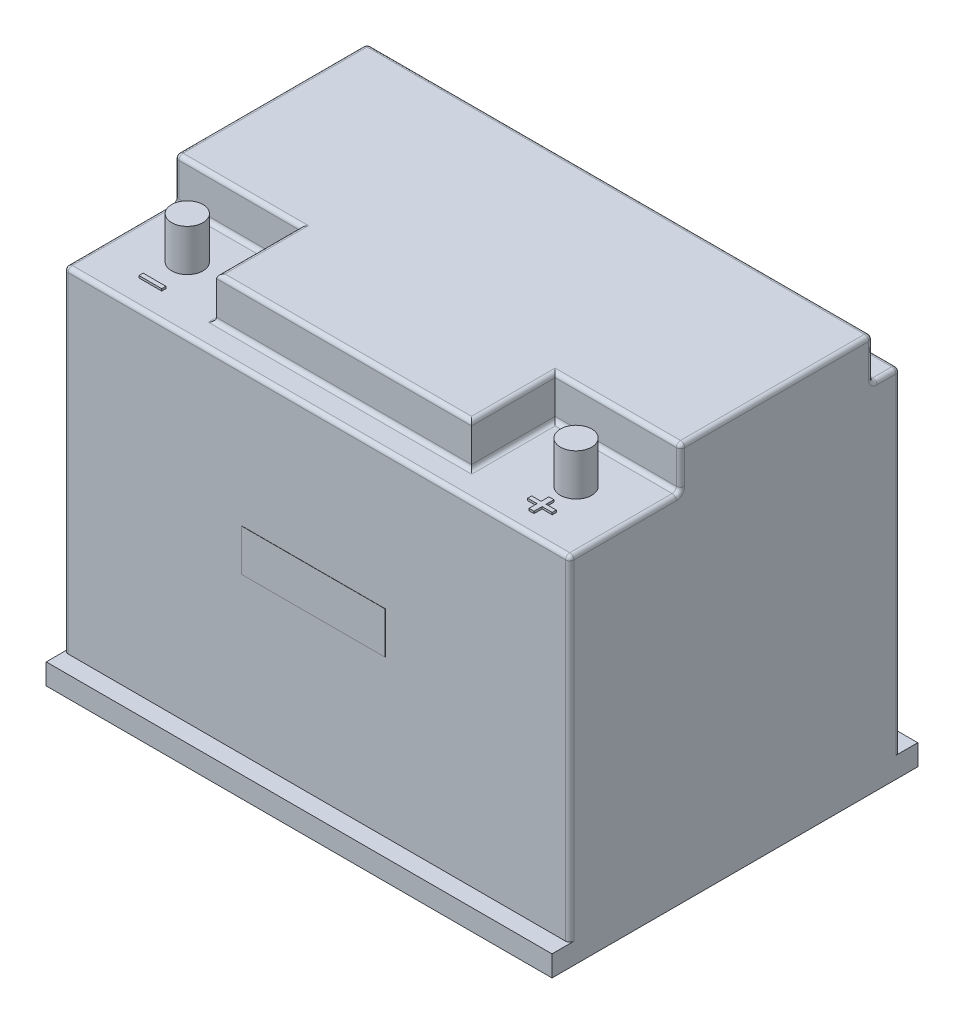
from build123d import *

# Parameters (mm, degrees)
SKETCH_1_W          = 242
SKETCH_1_H          = 175
EXTRUDE_1_DEPTH     = 10
SKETCH_2_W          = 242
SKETCH_2_H          = 158
EXTRUDE_2_DEPTH     = 160
SKETCH_3_W          = 242
SKETCH_3_H          = 132
EXTRUDE_3_DEPTH     = 20
SKETCH_4_W          = 60
SKETCH_4_H          = 40
CUT_EXTRUDE_1_DEPTH = 20
SKETCH_5_W          = 60
SKETCH_5_H          = 40
CUT_EXTRUDE_2_DEPTH = 20
FILLET_2_R          = 2
FILLET_3_R          = 2
FILLET_4_R          = 2
FILLET_5_R          = 2
FILLET_6_R          = 2
FILLET_7_R          = 2
FILLET_8_R          = 2
SKETCH_6_R          = 7.5
EXTRUDE_4_DEPTH     = 20
SKETCH_7_R          = 7.5
EXTRUDE_5_DEPTH     = 20
SKETCH_9_W          = 10.902570875
SKETCH_9_H          = 2.008368319
EXTRUDE_6_DEPTH     = 1
SKETCH_10_W         = 11.773146019
SKETCH_10_H         = 1.940628464
EXTRUDE_7_DEPTH     = 1
SKETCH_11_W         = 2.42536198
SKETCH_11_H         = 9.534181576
EXTRUDE_8_DEPTH     = 1
SKETCH_12_W         = 68.811606865
SKETCH_12_H         = 20.02454168
EXTRUDE_9_DEPTH     = 0.1


with BuildPart() as part:
    # 草图1 → 凸台-拉伸1 (new body)
    with BuildSketch(Plane(origin=(0, 0, 0), x_dir=(1, 0, 0), z_dir=(0, 1, 0))):
        Rectangle(SKETCH_1_W, SKETCH_1_H)
    extrude(amount=EXTRUDE_1_DEPTH)

    # 草图2 → 凸台-拉伸2 (add)
    with BuildSketch(Plane(origin=(0, 10, 0), x_dir=(1, 0, 0), z_dir=(0, 1, 0))):
        Rectangle(SKETCH_2_W, SKETCH_2_H)
    extrude(amount=EXTRUDE_2_DEPTH)

    # 草图3 → 凸台-拉伸3 (add)
    with BuildSketch(Plane(origin=(0, 170, 0), x_dir=(1, 0, 0), z_dir=(0, 1, 0))):
        Rectangle(SKETCH_3_W, SKETCH_3_H)
    extrude(amount=EXTRUDE_3_DEPTH)

    # 草图4 → 切除-拉伸1 (cut)
    with BuildSketch(Plane(origin=(0, 170, 0), x_dir=(1, 0, 0), z_dir=(0, 1, 0))):
        with Locations((-91, -46)):
            Rectangle(SKETCH_4_W, SKETCH_4_H)
    extrude(amount=CUT_EXTRUDE_1_DEPTH, mode=Mode.SUBTRACT)

    # 草图5 → 切除-拉伸2 (cut)
    with BuildSketch(Plane(origin=(0, 170, 0), x_dir=(1, 0, 0), z_dir=(0, 1, 0))):
        with Locations((91, -46)):
            Rectangle(SKETCH_5_W, SKETCH_5_H)
    extrude(amount=CUT_EXTRUDE_2_DEPTH, mode=Mode.SUBTRACT)

    # 圆角2
    fillet_2_edges = [part.edges().sort_by_distance(p)[0] for p in [
        (-121, 90, 79),
    ]]
    fillet(fillet_2_edges, radius=FILLET_2_R)

    # 圆角3
    fillet_3_edges = [part.edges().sort_by_distance(p)[0] for p in [
        (121, 90, 79),
    ]]
    fillet(fillet_3_edges, radius=FILLET_3_R)

    # 圆角4
    fillet_4_edges = [part.edges().sort_by_distance(p)[0] for p in [
        (121, 90, -79),
    ]]
    fillet(fillet_4_edges, radius=FILLET_4_R)

    # 圆角5
    fillet_5_edges = [part.edges().sort_by_distance(p)[0] for p in [
        (-121, 90, -79),
    ]]
    fillet(fillet_5_edges, radius=FILLET_5_R)

    # 圆角6
    fillet_6_edges = [part.edges().sort_by_distance(p)[0] for p in [
        (-61, 190, 46),
        (-91, 190, 26),
        (-121, 190, -20),
        (0, 190, -66),
        (121, 190, -20),
        (91, 190, 26),
        (61, 190, 46),
        (0, 190, 66),
    ]]
    fillet(fillet_6_edges, radius=FILLET_6_R)

    # 圆角7
    # the kernel refuses this fillet: 2 mm, written as the material it adds along each edge
    with BuildSketch(Plane(origin=(61, 170, 66), x_dir=(0, 0, 1), z_dir=(-1, 0, 0))) as fillet_7_piece_1:
        with BuildLine():
            CenterArc((FILLET_7_R, FILLET_7_R), FILLET_7_R, 180, 90)
            Line((0, FILLET_7_R), (0, 0))
            Line((0, 0), (FILLET_7_R, 0))
        make_face()
    extrude(amount=122)
    with BuildSketch(Plane(origin=(-121, 170, 26), x_dir=(0, 1, 0), z_dir=(1, 0, 0))) as fillet_7_piece_2:
        with BuildLine():
            CenterArc((FILLET_7_R, FILLET_7_R), FILLET_7_R, 180, 90)
            Line((0, FILLET_7_R), (0, 0))
            Line((0, 0), (FILLET_7_R, 0))
        make_face()
    extrude(amount=65)
    with BuildSketch(Plane(origin=(-61, 170, 21), x_dir=(-1, 0, 0), z_dir=(0, 0, 1)), Plane(origin=(61, 170, 66), x_dir=(1, 0, 0), z_dir=(0, 0, -1))) as fillet_7_piece_3:
        with BuildLine():
            CenterArc((FILLET_7_R, -FILLET_7_R), FILLET_7_R, 90, 90)
            Line((0, -FILLET_7_R), (0, 0))
            Line((0, 0), (FILLET_7_R, 0))
        make_face()
    extrude(amount=45)
    with BuildSketch(Plane(origin=(56, 170, 26), x_dir=(0, 0, 1), z_dir=(1, 0, 0))) as fillet_7_piece_4:
        with BuildLine():
            CenterArc((FILLET_7_R, -FILLET_7_R), FILLET_7_R, 90, 90)
            Line((0, -FILLET_7_R), (0, 0))
            Line((0, 0), (FILLET_7_R, 0))
        make_face()
    extrude(amount=65)
    with BuildSketch(Plane(origin=(61, 170, 71), x_dir=(1, 0, 0), z_dir=(0, 0, -1))) as fillet_7_piece_5a_section:
        with BuildLine():
            CenterArc((FILLET_7_R, -FILLET_7_R), FILLET_7_R, 90, 90)
            Line((0, -FILLET_7_R), (0, 0))
            Line((0, 0), (FILLET_7_R, 0))
        make_face()
    fillet_7_piece_5a = extrude(amount=45, mode=Mode.PRIVATE)
    fillet_7_piece_5a = split(fillet_7_piece_5a, bisect_by=Plane(origin=(61.452790229, 170.452790229, 66), z_dir=(0, 0, 1)), keep=Keep.TOP, mode=Mode.PRIVATE)
    with BuildSketch(Plane(origin=(66, 170, 66), x_dir=(0, 0, 1), z_dir=(-1, 0, 0))) as fillet_7_piece_5b_section:
        with BuildLine():
            CenterArc((FILLET_7_R, FILLET_7_R), FILLET_7_R, 180, 90)
            Line((0, FILLET_7_R), (0, 0))
            Line((0, 0), (FILLET_7_R, 0))
        make_face()
    fillet_7_piece_5b = extrude(amount=127, mode=Mode.PRIVATE)
    fillet_7_piece_5b = split(fillet_7_piece_5b, bisect_by=Plane(origin=(61, 170.452790229, 66.452790229), z_dir=(1, 0, 0)), keep=Keep.TOP, mode=Mode.PRIVATE)
    fillet_7_piece_5 = fillet_7_piece_5a & fillet_7_piece_5b
    add(fillet_7_piece_5)
    with BuildSketch(Plane(origin=(-61, 170, 26), x_dir=(-1, 0, 0), z_dir=(0, 0, 1))) as fillet_7_piece_6a_section:
        with BuildLine():
            CenterArc((FILLET_7_R, -FILLET_7_R), FILLET_7_R, 90, 90)
            Line((0, -FILLET_7_R), (0, 0))
            Line((0, 0), (FILLET_7_R, 0))
        make_face()
    fillet_7_piece_6a = extrude(amount=45, mode=Mode.PRIVATE)
    fillet_7_piece_6a = split(fillet_7_piece_6a, bisect_by=Plane(origin=(-61.452790229, 170.452790229, 66), z_dir=(0, 0, 1)), keep=Keep.TOP, mode=Mode.PRIVATE)
    with BuildSketch(Plane(origin=(61, 170, 66), x_dir=(0, 0, 1), z_dir=(-1, 0, 0))) as fillet_7_piece_6b_section:
        with BuildLine():
            CenterArc((FILLET_7_R, FILLET_7_R), FILLET_7_R, 180, 90)
            Line((0, FILLET_7_R), (0, 0))
            Line((0, 0), (FILLET_7_R, 0))
        make_face()
    fillet_7_piece_6b = extrude(amount=127, mode=Mode.PRIVATE)
    fillet_7_piece_6b = split(fillet_7_piece_6b, bisect_by=Plane(origin=(-61, 170.452790229, 66.452790229), z_dir=(-1, 0, 0)), keep=Keep.TOP, mode=Mode.PRIVATE)
    fillet_7_piece_6 = fillet_7_piece_6a & fillet_7_piece_6b
    add(fillet_7_piece_6)
    # the kernel refuses this fillet: 2 mm, written as the material it takes off along each edge
    with BuildSketch(Plane(origin=(119, 188, 24), x_dir=(0, 0, 1), z_dir=(1, 0, 0))) as fillet_7_2_piece_1_section:
        Polygon((0, 0), (FILLET_7_R, 0), (FILLET_7_R, -FILLET_7_R), (0, -FILLET_7_R), align=None)
    fillet_7_2_piece_1 = extrude(amount=FILLET_7_R, mode=Mode.PRIVATE)
    fillet_7_2_piece_1 = fillet_7_2_piece_1 - Plane(origin=(119, 188, 24), x_dir=(0, -0.7071067811865475, -0.7071067811865475), z_dir=(1, 0, 0)) * Sphere(FILLET_7_R, mode=Mode.PRIVATE)
    add(fillet_7_2_piece_1, mode=Mode.SUBTRACT)
    with BuildSketch(Plane(origin=(-119, 188, 24), x_dir=(-1, 0, 0), z_dir=(0, 0, 1))) as fillet_7_2_piece_2_section:
        Polygon((0, 0), (FILLET_7_R, 0), (FILLET_7_R, -FILLET_7_R), (0, -FILLET_7_R), align=None)
    fillet_7_2_piece_2 = extrude(amount=FILLET_7_R, mode=Mode.PRIVATE)
    fillet_7_2_piece_2 = fillet_7_2_piece_2 - Plane(origin=(-119, 188, 24), x_dir=(0.7071067811865475, -0.7071067811865475, 0), z_dir=(0, 0, 1)) * Sphere(FILLET_7_R, mode=Mode.PRIVATE)
    add(fillet_7_2_piece_2, mode=Mode.SUBTRACT)
    with BuildSketch(Plane(origin=(-121, 172, 26), x_dir=(1, 0, 0), z_dir=(0, 1, 0)), Plane(origin=(121, 172, 26), x_dir=(0, 0, -1), z_dir=(0, 1, 0))) as fillet_7_2_piece_3:
        with BuildLine():
            CenterArc((FILLET_7_R, FILLET_7_R), FILLET_7_R, 180, 90)
            Line((0, FILLET_7_R), (0, 0))
            Line((0, 0), (FILLET_7_R, 0))
        make_face()
    extrude(amount=16, mode=Mode.SUBTRACT)
    with BuildSketch(Plane(origin=(-121, 170, 77), x_dir=(1, 0, 0), z_dir=(0, 0, -1))) as fillet_7_2_piece_4:
        with BuildLine():
            CenterArc((FILLET_7_R, FILLET_7_R), FILLET_7_R, 180, 90)
            Line((0, FILLET_7_R), (0, 0))
            Line((0, 0), (FILLET_7_R, 0))
        make_face()
    extrude(amount=49, mode=Mode.SUBTRACT)
    with BuildSketch(Plane(origin=(119, 170, 79), x_dir=(0, -1, 0), z_dir=(-1, 0, 0))) as fillet_7_2_piece_5:
        with BuildLine():
            CenterArc((FILLET_7_R, -FILLET_7_R), FILLET_7_R, 90, 90)
            Line((0, -FILLET_7_R), (0, 0))
            Line((0, 0), (FILLET_7_R, 0))
        make_face()
    extrude(amount=238, mode=Mode.SUBTRACT)
    with BuildSketch(Plane(origin=(-119, 170, 77), x_dir=(0, 0, 1), z_dir=(1, 0, 0))) as fillet_7_2_piece_6:
        with BuildLine():
            CenterArc((2 - FILLET_7_R, FILLET_7_R), FILLET_7_R, 270, 90)
            Line((2 - FILLET_7_R, 0), (2, 0))
            Line((2, 0), (2, FILLET_7_R))
        make_face()
    revolve(axis=Axis((-119, 170, 77), (0, -1, 0)), revolution_arc=90, mode=Mode.SUBTRACT)
    with BuildSketch(Plane(origin=(121, 170, 28), x_dir=(0, -1, 0), z_dir=(0, 0, 1))) as fillet_7_2_piece_7:
        with BuildLine():
            CenterArc((FILLET_7_R, -FILLET_7_R), FILLET_7_R, 90, 90)
            Line((0, -FILLET_7_R), (0, 0))
            Line((0, 0), (FILLET_7_R, 0))
        make_face()
    extrude(amount=49, mode=Mode.SUBTRACT)
    with BuildSketch(Plane(origin=(119, 170, 77), x_dir=(1, 0, 0), z_dir=(0, 0, -1))) as fillet_7_2_piece_8:
        with BuildLine():
            CenterArc((2 - FILLET_7_R, FILLET_7_R), FILLET_7_R, 270, 90)
            Line((2 - FILLET_7_R, 0), (2, 0))
            Line((2, 0), (2, FILLET_7_R))
        make_face()
    revolve(axis=Axis((119, 170, 77), (0, -1, 0)), revolution_arc=90, mode=Mode.SUBTRACT)
    with BuildSketch(Plane(origin=(121, 172, 28), x_dir=(0, -1, 0), z_dir=(0, 0, 1))) as fillet_7_2_piece_9:
        with BuildLine():
            CenterArc((2 + FILLET_7_R, -FILLET_7_R), FILLET_7_R, 90, 90)
            Line((2, -FILLET_7_R), (2, 0))
            Line((2, 0), (2 + FILLET_7_R, 0))
        make_face()
    revolve(axis=Axis((121, 172, 28), (1, 0, 0)), revolution_arc=90, mode=Mode.SUBTRACT)
    with BuildSketch(Plane(origin=(-121, 172, 28), x_dir=(0, 0, -1), z_dir=(0, 1, 0))) as fillet_7_2_piece_10:
        with BuildLine():
            CenterArc((2 + FILLET_7_R, -FILLET_7_R), FILLET_7_R, 90, 90)
            Line((2 + FILLET_7_R, 0), (2, 0))
            Line((2, 0), (2, -FILLET_7_R))
        make_face()
    revolve(axis=Axis((-121, 172, 28), (-1, 0, 0)), revolution_arc=90, mode=Mode.SUBTRACT)

    # 圆角8
    # the kernel refuses this fillet: 2 mm, written as the material it adds along each edge
    with BuildSketch(Plane(origin=(-121, 170, -66), x_dir=(0, 0, -1), z_dir=(1, 0, 0))) as fillet_8_piece_1:
        with BuildLine():
            CenterArc((FILLET_8_R, FILLET_8_R), FILLET_8_R, 180, 90)
            Line((0, FILLET_8_R), (0, 0))
            Line((0, 0), (FILLET_8_R, 0))
        make_face()
    extrude(amount=242)
    # the kernel refuses this fillet: 2 mm, written as the material it takes off along each edge
    with BuildSketch(Plane(origin=(119, 188, -64), x_dir=(0, 0, -1), z_dir=(1, 0, 0))) as fillet_8_2_piece_1_section:
        Polygon((0, 0), (FILLET_8_R, 0), (FILLET_8_R, FILLET_8_R), (0, FILLET_8_R), align=None)
    fillet_8_2_piece_1 = extrude(amount=FILLET_8_R, mode=Mode.PRIVATE)
    fillet_8_2_piece_1 = fillet_8_2_piece_1 - Plane(origin=(119, 188, -64), x_dir=(0, -0.7071067811865475, 0.7071067811865475), z_dir=(1, 0, 0)) * Sphere(FILLET_8_R, mode=Mode.PRIVATE)
    add(fillet_8_2_piece_1, mode=Mode.SUBTRACT)
    with BuildSketch(Plane(origin=(-119, 188, -64), x_dir=(0, 0, -1), z_dir=(-1, 0, 0))) as fillet_8_2_piece_2_section:
        Polygon((0, 0), (FILLET_8_R, 0), (FILLET_8_R, -FILLET_8_R), (0, -FILLET_8_R), align=None)
    fillet_8_2_piece_2 = extrude(amount=FILLET_8_R, mode=Mode.PRIVATE)
    fillet_8_2_piece_2 = fillet_8_2_piece_2 - Plane(origin=(-119, 188, -64), x_dir=(0, -0.7071067811865475, 0.7071067811865475), z_dir=(-1, 0, 0)) * Sphere(FILLET_8_R, mode=Mode.PRIVATE)
    add(fillet_8_2_piece_2, mode=Mode.SUBTRACT)
    with BuildSketch(Plane(origin=(119, 170, -77), x_dir=(0, 0, -1), z_dir=(-1, 0, 0))) as fillet_8_2_piece_3:
        with BuildLine():
            CenterArc((2 - FILLET_8_R, FILLET_8_R), FILLET_8_R, 270, 90)
            Line((2, FILLET_8_R), (2, 0))
            Line((2, 0), (2 - FILLET_8_R, 0))
        make_face()
    revolve(axis=Axis((119, 170, -77), (0, -1, 0)), revolution_arc=90, mode=Mode.SUBTRACT)
    with BuildSketch(Plane(origin=(-121, 170, -68), x_dir=(0, -1, 0), z_dir=(0, 0, -1)), Plane(origin=(121, 170, -77), x_dir=(0, -1, 0), z_dir=(0, 0, 1))) as fillet_8_2_piece_4:
        with BuildLine():
            CenterArc((FILLET_8_R, -FILLET_8_R), FILLET_8_R, 90, 90)
            Line((0, -FILLET_8_R), (0, 0))
            Line((0, 0), (FILLET_8_R, 0))
        make_face()
    extrude(amount=9, mode=Mode.SUBTRACT)
    with BuildSketch(Plane(origin=(-119, 170, -77), x_dir=(-1, 0, 0), z_dir=(0, 0, 1))) as fillet_8_2_piece_5:
        with BuildLine():
            CenterArc((2 - FILLET_8_R, FILLET_8_R), FILLET_8_R, 270, 90)
            Line((2 - FILLET_8_R, 0), (2, 0))
            Line((2, 0), (2, FILLET_8_R))
        make_face()
    revolve(axis=Axis((-119, 170, -77), (0, -1, 0)), revolution_arc=90, mode=Mode.SUBTRACT)
    with BuildSketch(Plane(origin=(-121, 172, -66), x_dir=(0, 0, 1), z_dir=(0, 1, 0))) as fillet_8_2_piece_6:
        with BuildLine():
            CenterArc((FILLET_8_R, FILLET_8_R), FILLET_8_R, 180, 90)
            Line((0, FILLET_8_R), (0, 0))
            Line((0, 0), (FILLET_8_R, 0))
        make_face()
    extrude(amount=16, mode=Mode.SUBTRACT)
    with BuildSketch(Plane(origin=(121, 172, -66), x_dir=(0, 0, 1), z_dir=(0, 1, 0))) as fillet_8_2_piece_7:
        with BuildLine():
            CenterArc((FILLET_8_R, -FILLET_8_R), FILLET_8_R, 90, 90)
            Line((0, -FILLET_8_R), (0, 0))
            Line((0, 0), (FILLET_8_R, 0))
        make_face()
    extrude(amount=16, mode=Mode.SUBTRACT)
    with BuildSketch(Plane(origin=(-119, 170, -79), x_dir=(0, 0, 1), z_dir=(1, 0, 0))) as fillet_8_2_piece_8:
        with BuildLine():
            CenterArc((FILLET_8_R, FILLET_8_R), FILLET_8_R, 180, 90)
            Line((0, FILLET_8_R), (0, 0))
            Line((0, 0), (FILLET_8_R, 0))
        make_face()
    extrude(amount=238, mode=Mode.SUBTRACT)
    with BuildSketch(Plane(origin=(121, 172, -68), x_dir=(0, -1, 0), z_dir=(0, 0, -1))) as fillet_8_2_piece_9:
        with BuildLine():
            CenterArc((2 + FILLET_8_R, FILLET_8_R), FILLET_8_R, 180, 90)
            Line((2, FILLET_8_R), (2, 0))
            Line((2, 0), (2 + FILLET_8_R, 0))
        make_face()
    revolve(axis=Axis((121, 172, -68), (-1, 0, 0)), revolution_arc=90, mode=Mode.SUBTRACT)
    with BuildSketch(Plane(origin=(-121, 172, -68), x_dir=(0, -1, 0), z_dir=(0, 0, -1))) as fillet_8_2_piece_10:
        with BuildLine():
            CenterArc((2 + FILLET_8_R, -FILLET_8_R), FILLET_8_R, 90, 90)
            Line((2, -FILLET_8_R), (2, 0))
            Line((2, 0), (2 + FILLET_8_R, 0))
        make_face()
    revolve(axis=Axis((-121, 172, -68), (-1, 0, 0)), revolution_arc=90, mode=Mode.SUBTRACT)

    # 草图6 → 凸台-拉伸4 (add)
    with BuildSketch(Plane(origin=(0, 170, 0), x_dir=(1, 0, 0), z_dir=(0, 1, 0))):
        with Locations(Location((-93, -48, 0), (0, 0, 270))):
            Circle(SKETCH_6_R)
    extrude(amount=EXTRUDE_4_DEPTH)

    # 草图7 → 凸台-拉伸5 (add)
    with BuildSketch(Plane(origin=(0, 170, 0), x_dir=(1, 0, 0), z_dir=(0, 1, 0))):
        with Locations(Location((93, -48, 0), (0, 0, 270))):
            Circle(SKETCH_7_R)
    extrude(amount=EXTRUDE_5_DEPTH)

    # 草图9 → 凸台-拉伸6 (add)
    with BuildSketch(Plane(origin=(0, 170, 0), x_dir=(1, 0, 0), z_dir=(0, 1, 0))):
        with Locations((-92.451285438, -65.23464498)):
            Rectangle(SKETCH_9_W, SKETCH_9_H)
    extrude(amount=EXTRUDE_6_DEPTH)

    # 草图10 → 凸台-拉伸7 (add)
    with BuildSketch(Plane(origin=(0, 170, 0), x_dir=(1, 0, 0), z_dir=(0, 1, 0))):
        with Locations((93.2336389, -64.560754974)):
            Rectangle(SKETCH_10_W, SKETCH_10_H)
    extrude(amount=EXTRUDE_7_DEPTH)

    # 草图11 → 凸台-拉伸8 (add)
    with BuildSketch(Plane(origin=(0, 170, 0), x_dir=(1, 0, 0), z_dir=(0, 1, 0))):
        with Locations((93.064353377, -64.621916085)):
            Rectangle(SKETCH_11_W, SKETCH_11_H)
    extrude(amount=EXTRUDE_8_DEPTH)

    # 草图12 → 凸台-拉伸9 (add)
    with BuildSketch(Plane.XY.offset(79)):
        with Locations((-1.666280354, 94.599564074)):
            Rectangle(SKETCH_12_W, SKETCH_12_H)
    extrude(amount=EXTRUDE_9_DEPTH)


solid = part.part
